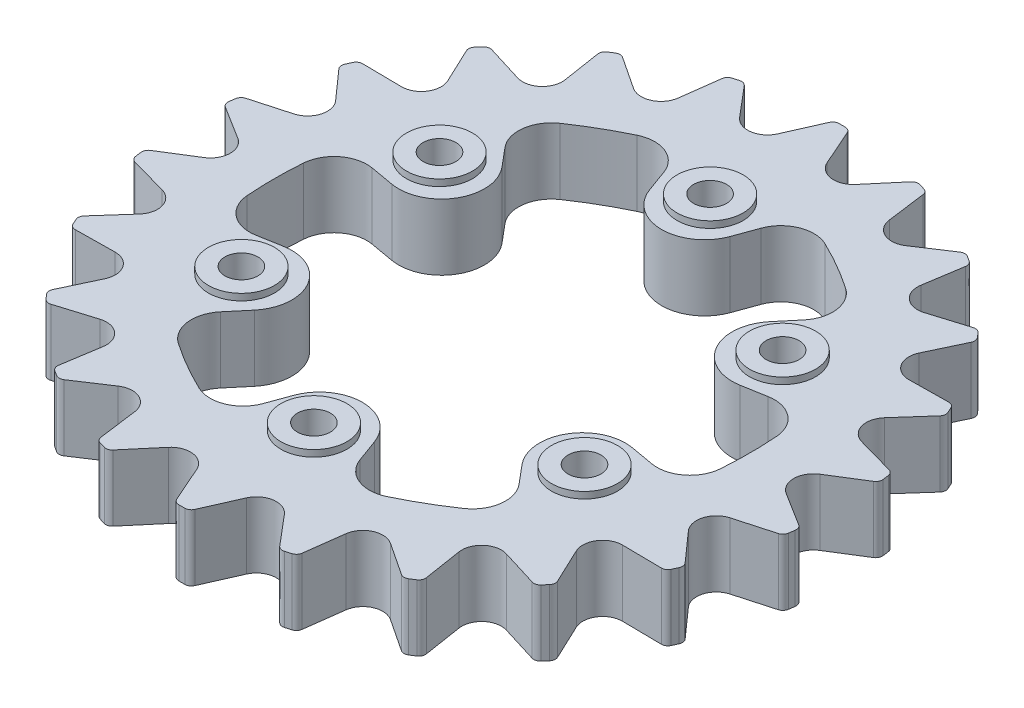
from build123d import *

# Parameters (mm, degrees)
SKETCH_1_W                       = 50
SKETCH_1_H                       = 10
CUT_REVOLVE_START                = -5
CUT_REVOLVE_1_DEPTH              = 10
FILLET_1_R                       = 1
FILLET_2_R                       = 3
PATTERN_CIRCULAR_1_COUNT         = 22
FILLET_1_OF_PATTERN_CIRCULAR_1_R = 1
FILLET_2_OF_PATTERN_CIRCULAR_1_R = 3
CUT_REVOLVE_2_DEPTH              = 10
FILLET_6_R                       = 5
PATTERN_CIRCULAR_2_COUNT         = 6
FILLET_6_OF_PATTERN_CIRCULAR_2_R = 5
SKETCH_6_W                       = 2.5
SKETCH_6_H                       = 12
SKETCH_6_3_W                     = 2.5
SKETCH_6_3_H                     = 12
FILLET_7_R                       = 6.5
PATTERN_START                    = -5
PATTERN_CIRCULAR_3_OUTLINE_R     = 2.5
PATTERN_CIRCULAR_3_DEPTH         = 10
PATTERN_START_2                  = -6
PATTERN_CIRCULAR_3_2_OUTLINE_R   = 5
PATTERN_CIRCULAR_3_2_OUTLINE_R_2 = 2.5
PATTERN_CIRCULAR_3_2_DEPTH       = 12


with BuildPart() as part:
    # Эскиз1 → Повернуть1 (revolve)
    with BuildSketch(Plane.XY, mode=Mode.PRIVATE) as revolve_1_sk:
        with Locations((25, 0)):
            Rectangle(SKETCH_1_W, SKETCH_1_H)
    revolve(revolve_1_sk.sketch.rotate(Axis((0, -5, 0), (0, 1, 0)), 90), axis=Axis((0, -5, 0), (0, 1, 0)))

    # Вырез-Повернуть1: read off the stored shape, not the designer's step
    # Вырез-Повернуть1 outline → Вырез-Повернуть1 (cut)
    with BuildSketch(Plane(origin=(0, 0, 0), x_dir=(1, 0, 0), z_dir=(0, 1, 0)).offset(CUT_REVOLVE_START)):
        with BuildLine():
            Line((-49.63611386, -6.021312223), (-40, 0))
            Line((-40, 0), (-49.63611386, 6.021312223))
            ThreePointArc((-49.63611386, 6.021312223), (-50, 0), (-49.63611386, -6.021312223))
        make_face()
    cut_revolve_1 = extrude(amount=CUT_REVOLVE_1_DEPTH, mode=Mode.SUBTRACT)

    # Скругление1
    fillet_1_edges = [part.edges().sort_by_distance(p)[0] for p in [
        (-49.63611386, 0, -6.021312223),
        (-49.63611386, 0, 6.021312223),
    ]]
    fillet(fillet_1_edges, radius=FILLET_1_R)

    # Скругление2
    fillet_2_edges = [part.edges().sort_by_distance(p)[0] for p in [
        (-40, 0, 0),
    ]]
    fillet(fillet_2_edges, radius=FILLET_2_R)

    # Круговой массив1: Вырез-Повернуть1 ×22 about axis
    pattern_circular_1_axis = Axis((0, 0, 0), (0, 1, 0))
    for i in range(1, PATTERN_CIRCULAR_1_COUNT):
        add(cut_revolve_1.rotate(pattern_circular_1_axis, i * 360 / PATTERN_CIRCULAR_1_COUNT), mode=Mode.SUBTRACT)

    # Скругление1 of Круговой массив1
    fillet_1_of_pattern_circular_1_edges = [part.edges().sort_by_distance(p)[0] for p in [
        (-49.321902174, 0, 8.2067025),
        (-45.929102798, 0, 19.761516039),
        (-45.011923303, 0, 21.769858993),
        (-38.501188978, 0, 31.900759352),
        (-37.055346102, 0, 33.569350981),
        (-27.954137803, 0, 41.455592864),
        (-26.096765137, 0, 42.649253797),
        (-15.142408632, 0, 47.651940788),
        (-13.023979463, 0, 48.273967715),
        (-1.10393157, 0, 49.987811865),
        (1.10393157, 0, 49.987811865),
        (13.023979463, 0, 48.273967715),
        (15.142408632, 0, 47.651940788),
        (26.096765137, 0, 42.649253797),
        (27.954137803, 0, 41.455592864),
        (37.055346102, 0, 33.569350981),
        (38.501188978, 0, 31.900759352),
        (45.011923303, 0, 21.769858993),
        (45.929102798, 0, 19.761516039),
        (49.321902174, 0, 8.2067025),
        (49.63611386, 0, 6.021312223),
        (49.63611386, 0, -6.021312223),
        (49.321902174, 0, -8.2067025),
        (45.929102798, 0, -19.761516039),
        (45.011923303, 0, -21.769858993),
        (38.501188978, 0, -31.900759352),
        (37.055346102, 0, -33.569350981),
        (27.954137803, 0, -41.455592864),
        (26.096765137, 0, -42.649253797),
        (15.142408632, 0, -47.651940788),
        (13.023979463, 0, -48.273967715),
        (1.10393157, 0, -49.987811865),
        (-1.10393157, 0, -49.987811865),
        (-13.023979463, 0, -48.273967715),
        (-15.142408632, 0, -47.651940788),
        (-26.096765137, 0, -42.649253797),
        (-27.954137803, 0, -41.455592864),
        (-37.055346102, 0, -33.569350981),
        (-38.501188978, 0, -31.900759352),
        (-45.011923303, 0, -21.769858993),
        (-45.929102798, 0, -19.761516039),
        (-49.321902174, 0, -8.2067025),
    ]]
    fillet(fillet_1_of_pattern_circular_1_edges, radius=FILLET_1_OF_PATTERN_CIRCULAR_1_R)

    # Скругление2 of Круговой массив1
    fillet_2_of_pattern_circular_1_edges = [part.edges().sort_by_distance(p)[0] for p in [
        (-38.379718945, 0, 11.269302274),
        (-33.650141313, 0, 21.625632698),
        (-26.194429358, 0, 30.229982974),
        (-16.61660052, 0, 36.385279814),
        (-5.692593531, 0, 39.592857675),
        (5.692593531, 0, 39.592857675),
        (16.61660052, 0, 36.385279814),
        (26.194429358, 0, 30.229982974),
        (33.650141313, 0, 21.625632698),
        (38.379718945, 0, 11.269302274),
        (40, 0, 0),
        (38.379718945, 0, -11.269302274),
        (33.650141313, 0, -21.625632698),
        (26.194429358, 0, -30.229982974),
        (16.61660052, 0, -36.385279814),
        (5.692593531, 0, -39.592857675),
        (-5.692593531, 0, -39.592857675),
        (-16.61660052, 0, -36.385279814),
        (-26.194429358, 0, -30.229982974),
        (-33.650141313, 0, -21.625632698),
        (-38.379718945, 0, -11.269302274),
    ]]
    fillet(fillet_2_of_pattern_circular_1_edges, radius=FILLET_2_OF_PATTERN_CIRCULAR_1_R)

    # Вырез-Повернуть2: read off the stored shape, not the designer's step
    # Вырез-Повернуть2 outline → Вырез-Повернуть2 (cut)
    with BuildSketch(Plane(origin=(0, 0, 0), x_dir=(1, 0, 0), z_dir=(0, 1, 0)).offset(CUT_REVOLVE_START)):
        with BuildLine():
            Line((20, 0), (-35.149234169, 9.724297949))
            ThreePointArc((-35.149234169, 9.724297949), (-36, 0), (-35.149234169, -9.724297949))
            Line((-35.149234169, -9.724297949), (20, 0))
        make_face()
    cut_revolve_2 = extrude(amount=CUT_REVOLVE_2_DEPTH, mode=Mode.SUBTRACT)

    # Скругление6
    fillet_6_edges = [part.edges().sort_by_distance(p)[0] for p in [
        (-35.149234169, 0, -9.724297949),
        (-35.149234169, 0, 9.724297949),
    ]]
    fillet(fillet_6_edges, radius=FILLET_6_R)

    # Круговой массив2: Вырез-Повернуть2 ×6 about axis
    pattern_circular_2_axis = Axis((0, 0, 0), (0, 1, 0))
    for i in range(1, PATTERN_CIRCULAR_2_COUNT):
        add(cut_revolve_2.rotate(pattern_circular_2_axis, i * 360 / PATTERN_CIRCULAR_2_COUNT), mode=Mode.SUBTRACT)

    # Скругление6 of Круговой массив2
    fillet_6_of_pattern_circular_2_edges = [part.edges().sort_by_distance(p)[0] for p in [
        (-25.996106142, 0, 25.577980739),
        (-9.153128027, 0, 35.302278688),
        (9.153128027, 0, 35.302278688),
        (25.996106142, 0, 25.577980739),
        (35.149234169, 0, 9.724297949),
        (35.149234169, 0, -9.724297949),
        (25.996106142, 0, -25.577980739),
        (9.153128027, 0, -35.302278688),
        (-9.153128027, 0, -35.302278688),
        (-25.996106142, 0, -25.577980739),
    ]]
    fillet(fillet_6_of_pattern_circular_2_edges, radius=FILLET_6_OF_PATTERN_CIRCULAR_2_R)

    # Эскиз6 → Повернуть2 (revolve)
    with BuildSketch(Plane(origin=(0, 0, 0), x_dir=(0, 0, -1), z_dir=(1, 0, 0))):
        with Locations((31.25, 0)):
            Rectangle(SKETCH_6_W, SKETCH_6_H)
        with Locations((33.75, 0)):
            Rectangle(SKETCH_6_W, SKETCH_6_H)
    revolve(axis=Axis((0, -6, -30), (0, 1, 0)))

    # Эскиз6<3> → Вырез-Повернуть3 (revolve, cut)
    with BuildSketch(Plane(origin=(0, 0, 0), x_dir=(0, 0, -1), z_dir=(1, 0, 0))):
        with Locations((31.25, 0)):
            Rectangle(SKETCH_6_3_W, SKETCH_6_3_H)
    revolve(axis=Axis((0, -6, -30), (0, 1, 0)), mode=Mode.SUBTRACT)

    # Скругление7
    fillet_7_edges = [part.edges().sort_by_distance(p)[0] for p in [
        (-8.793852415, 0, -5.077133059),
        (0, 0, -10.154266118),
        (8.793852415, 0, -5.077133059),
        (8.793852415, 0, 5.077133059),
        (0, 0, 10.154266118),
        (-8.793852415, 0, 5.077133059),
    ]]
    fillet(fillet_7_edges, radius=FILLET_7_R)

    # Круговой массив3: read off the stored shape, not the designer's step
    # Круговой массив3 outline → Круговой массив3 (cut)
    with BuildSketch(Plane(origin=(0, 0, 0), x_dir=(1, 0, 0), z_dir=(0, 1, 0)).offset(PATTERN_START)):
        with Locations((25.980762114, 15)):
            Circle(PATTERN_CIRCULAR_3_OUTLINE_R)
        with Locations((25.980762114, -15)):
            Circle(PATTERN_CIRCULAR_3_OUTLINE_R)
        with Locations((0, -30)):
            Circle(PATTERN_CIRCULAR_3_OUTLINE_R)
        with Locations((-25.980762114, -15)):
            Circle(PATTERN_CIRCULAR_3_OUTLINE_R)
        with Locations((-25.980762114, 15)):
            Circle(PATTERN_CIRCULAR_3_OUTLINE_R)
    extrude(amount=PATTERN_CIRCULAR_3_DEPTH, mode=Mode.SUBTRACT)

    # Pattern Circular 3 2 outline → Pattern Circular 3 2 (add)
    # profile 1 of 5: a face of its own
    with BuildSketch(Plane(origin=(0, 0, 0), x_dir=(1, 0, 0), z_dir=(0, 1, 0)).offset(PATTERN_START_2)):
        with Locations((25.980762114, 15)):
            Circle(PATTERN_CIRCULAR_3_2_OUTLINE_R)
        with Locations((25.980762114, 15)):
            Circle(PATTERN_CIRCULAR_3_2_OUTLINE_R_2, mode=Mode.SUBTRACT)
    # profile 2 of 5: a face of its own
    with BuildSketch(Plane(origin=(0, 0, 0), x_dir=(1, 0, 0), z_dir=(0, 1, 0)).offset(PATTERN_START_2)):
        with Locations((25.980762114, -15)):
            Circle(PATTERN_CIRCULAR_3_2_OUTLINE_R)
        with Locations((25.980762114, -15)):
            Circle(PATTERN_CIRCULAR_3_2_OUTLINE_R_2, mode=Mode.SUBTRACT)
    # profile 3 of 5: a face of its own
    with BuildSketch(Plane(origin=(0, 0, 0), x_dir=(1, 0, 0), z_dir=(0, 1, 0)).offset(PATTERN_START_2)):
        with Locations((0, -30)):
            Circle(PATTERN_CIRCULAR_3_2_OUTLINE_R)
        with Locations((0, -30)):
            Circle(PATTERN_CIRCULAR_3_2_OUTLINE_R_2, mode=Mode.SUBTRACT)
    # profile 4 of 5: a face of its own
    with BuildSketch(Plane(origin=(0, 0, 0), x_dir=(1, 0, 0), z_dir=(0, 1, 0)).offset(PATTERN_START_2)):
        with Locations((-25.980762114, -15)):
            Circle(PATTERN_CIRCULAR_3_2_OUTLINE_R)
        with Locations((-25.980762114, -15)):
            Circle(PATTERN_CIRCULAR_3_2_OUTLINE_R_2, mode=Mode.SUBTRACT)
    # profile 5 of 5: a face of its own
    with BuildSketch(Plane(origin=(0, 0, 0), x_dir=(1, 0, 0), z_dir=(0, 1, 0)).offset(PATTERN_START_2)):
        with Locations((-25.980762114, 15)):
            Circle(PATTERN_CIRCULAR_3_2_OUTLINE_R)
        with Locations((-25.980762114, 15)):
            Circle(PATTERN_CIRCULAR_3_2_OUTLINE_R_2, mode=Mode.SUBTRACT)
    extrude(amount=PATTERN_CIRCULAR_3_2_DEPTH)


solid = part.part
